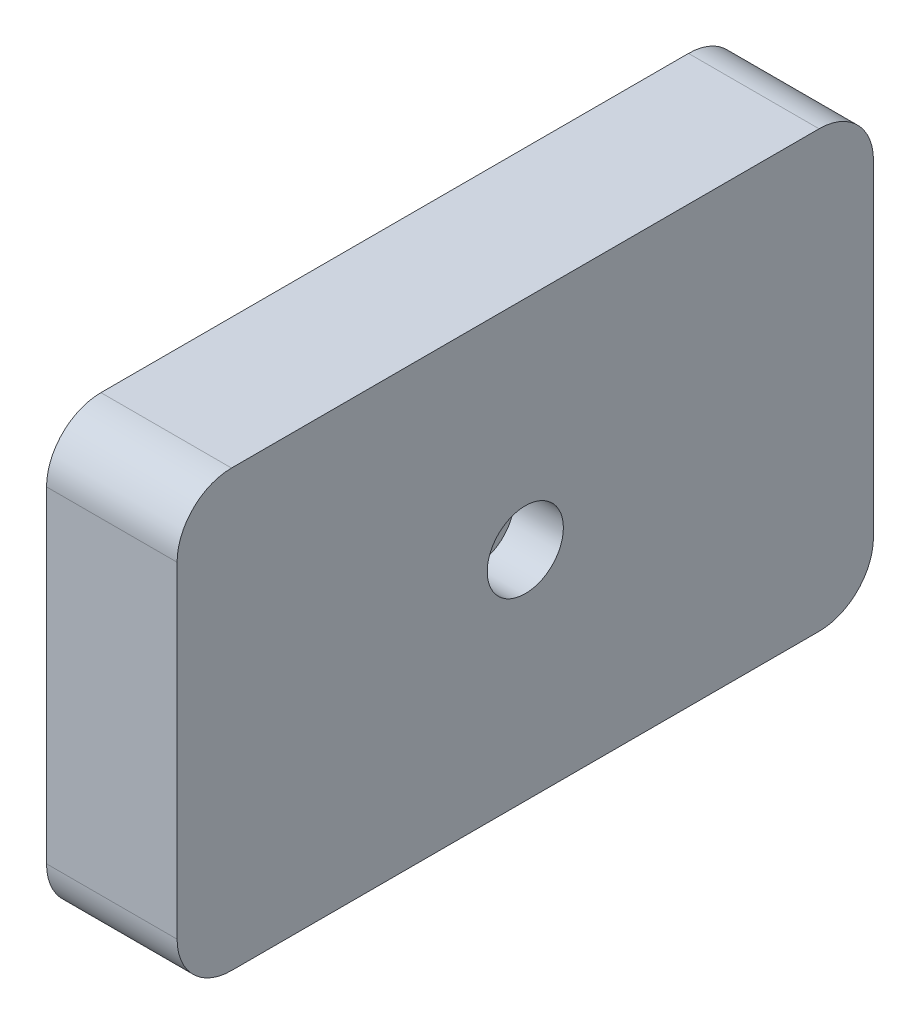
from build123d import *

# Parameters (mm, degrees)
EXTRUDE_1_DEPTH     = 12
SKETCH_2_R          = 8
CUT_EXTRUDE_1_DEPTH = 5


with BuildPart() as part:
    # 草图1 → 凸台-拉伸1 (new body)
    with BuildSketch(Plane(origin=(0, 0, 0), x_dir=(0, 0, -1), z_dir=(1, 0, 0))):
        with BuildLine():
            Line((-27, 20), (27, 20))
            ThreePointArc((27, 20), (30.535533906, 18.535533906), (32, 15))
            Line((32, 15), (32, -15))
            ThreePointArc((32, -15), (30.535533906, -18.535533906), (27, -20))
            Line((27, -20), (-27, -20))
            ThreePointArc((-27, -20), (-30.535533906, -18.535533906), (-32, -15))
            Line((-32, -15), (-32, 15))
            ThreePointArc((-32, 15), (-30.535533906, 18.535533906), (-27, 20))
        make_face()
    extrude(amount=EXTRUDE_1_DEPTH)

    # 草图2 → 切除-拉伸1 (cut)
    with BuildSketch(Plane.ZY):
        Circle(SKETCH_2_R)
    extrude(amount=-CUT_EXTRUDE_1_DEPTH, mode=Mode.SUBTRACT)

    # 草图5 → 孔1 (revolve, cut)
    with BuildSketch(Plane(origin=(12, 0, 0), x_dir=(0, 0, -1), z_dir=(0, 1, 0))):
        Polygon((0, 0), (0, 12), (2, 12), (2, 4.5), (3.5, 4.5), (3.5, 0), align=None)
    revolve(axis=Axis((18.35, 0, 0), (-1, 0, 0)), mode=Mode.SUBTRACT)


solid = part.part
